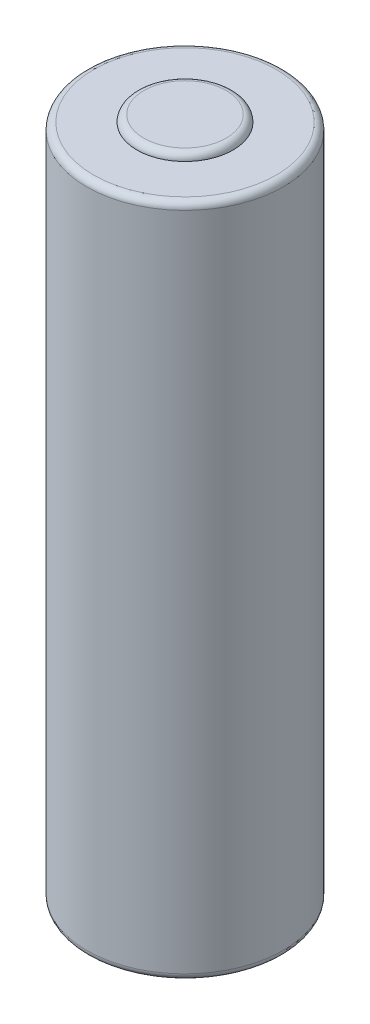
from build123d import *

# Parameters (mm, degrees)
SKETCH1_R           = 7.15
BOSS_EXTRUDE1_DEPTH = 24.5635
SKETCH2_R           = 3.5
BOSS_EXTRUDE2_DEPTH = 0.5
FILLET1_R           = 0.5


with BuildPart() as part:
    # Sketch1 → Boss-Extrude1 (new, symmetric)
    with BuildSketch(Plane(origin=(0, 0, 0), x_dir=(1, 0, 0), z_dir=(0, 1, 0))):
        with Locations(Location((0, 0, 0), (0, 0, 270))):
            Circle(SKETCH1_R)
    extrude(amount=BOSS_EXTRUDE1_DEPTH, both=True)

    # Sketch2 → Boss-Extrude2 (add)
    with BuildSketch(Plane(origin=(0, 24.5635, 0), x_dir=(1, 0, 0), z_dir=(0, 1, 0))):
        with Locations(Location((0, 0, 0), (0, 0, 270))):
            Circle(SKETCH2_R)
    extrude(amount=BOSS_EXTRUDE2_DEPTH)

    # Fillet1
    fillet1_edges = [part.edges().sort_by_distance(p)[0] for p in [
        (0, -24.5635, -7.15),
        (0, 24.5635, -7.15),
        (0, 25.0635, -3.5),
    ]]
    fillet(fillet1_edges, radius=FILLET1_R - 0.0001)  # a hair under: the kernel refuses the full size


solid = part.part
